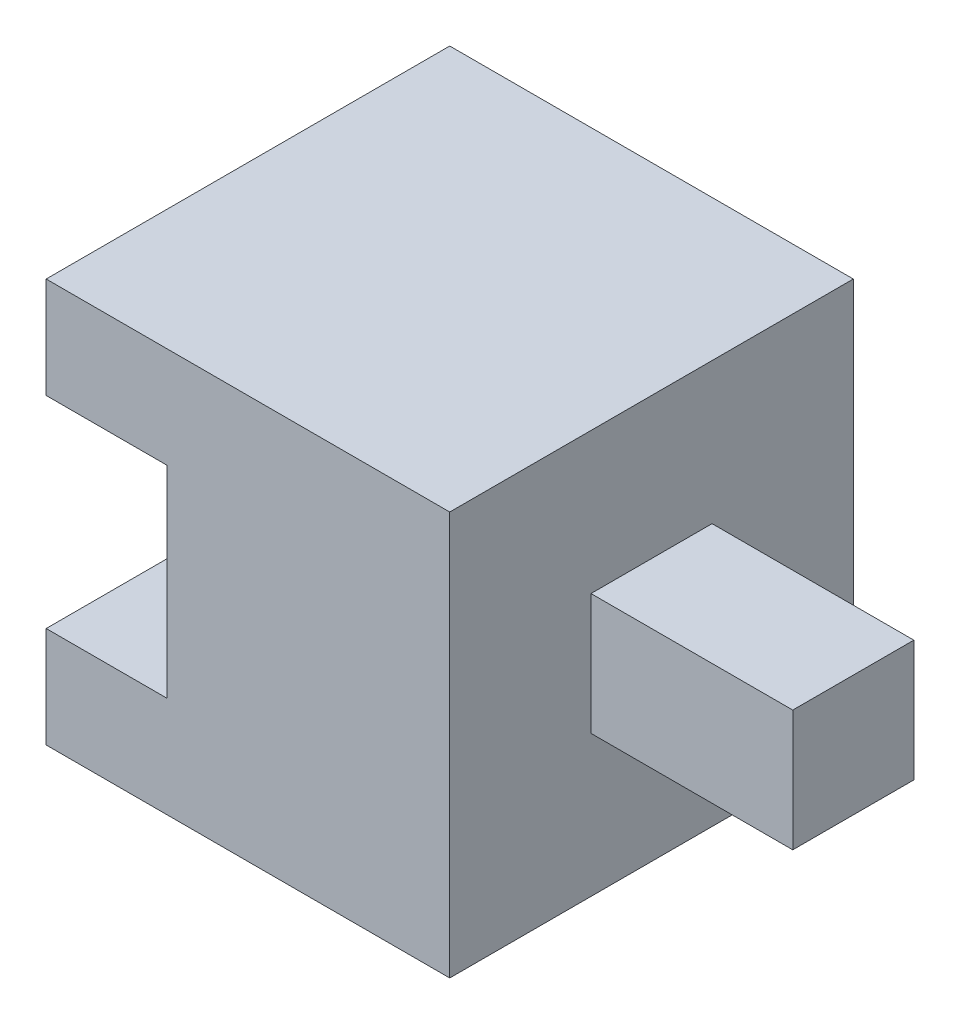
from build123d import *

# Parameters (mm, degrees)
SKETCH1_W           = 10
SKETCH1_H           = 10
BOSS_EXTRUDE1_DEPTH = 5
SKETCH2_W           = 3
SKETCH2_H           = 5
CUT_EXTRUDE1_DEPTH  = 13.247448714
SKETCH3_W           = 3
SKETCH3_H           = 3
BOSS_EXTRUDE2_DEPTH = 5


with BuildPart() as part:
    # Sketch1 → Boss-Extrude1 (new, symmetric)
    with BuildSketch(Plane(origin=(0, 0, 0), x_dir=(1, 0, 0), z_dir=(0, 1, 0))):
        Rectangle(SKETCH1_W, SKETCH1_H)
    extrude(amount=BOSS_EXTRUDE1_DEPTH, both=True)

    # Sketch2 → Cut-Extrude1 (cut, through all)
    with BuildSketch(Plane.XY.offset(5)):
        with Locations((-3.5, 0)):
            Rectangle(SKETCH2_W, SKETCH2_H)
    extrude(amount=-CUT_EXTRUDE1_DEPTH, mode=Mode.SUBTRACT)

    # Sketch3 → Boss-Extrude2 (add)
    with BuildSketch(Plane(origin=(5, 0, 0), x_dir=(0, 0, -1), z_dir=(1, 0, 0))):
        Rectangle(SKETCH3_W, SKETCH3_H)
    extrude(amount=BOSS_EXTRUDE2_DEPTH)


solid = part.part
